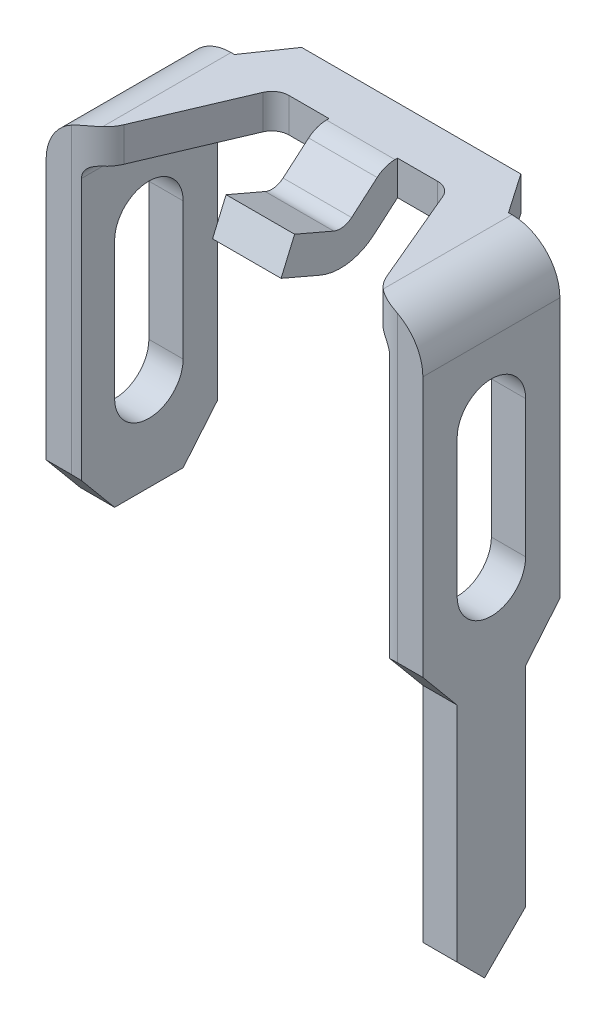
from build123d import *

# Parameters (mm, degrees)
BOSS_EXTRUDE1_DEPTH = 2.58
CUT_EXTRUDE1_DEPTH  = 10.5
CUT_EXTRUDE2_DEPTH  = 5.25
BOSS_EXTRUDE2_DEPTH = 0.5
SKETCH5_W           = 2.430822105
SKETCH5_H           = 5.029930807
CUT_EXTRUDE3_DEPTH  = 1
CHAMFER1_SIZE       = 0.6
CHAMFER2_SIZE       = 0.4


with BuildPart() as part:
    # Sketch1 → Boss-Extrude1 (new body)
    with BuildSketch(Plane.XY):
        with BuildLine():
            Line((-2.75, -4), (-2.75, 4.05))
            ThreePointArc((-2.75, 4.05), (-2.544974747, 4.544974747), (-2.05, 4.75))
            Line((-2.05, 4.75), (2.05, 4.75))
            ThreePointArc((2.05, 4.75), (2.544974747, 4.544974747), (2.75, 4.05))
            Line((2.75, 4.05), (2.75, -4))
            Line((2.75, -4), (2.25, -4))
            Line((2.25, -4), (2.25, 4.05))
            ThreePointArc((2.25, 4.05), (2.191421356, 4.191421356), (2.05, 4.25))
            Line((2.05, 4.25), (-2.05, 4.25))
            ThreePointArc((-2.05, 4.25), (-2.191421356, 4.191421356), (-2.25, 4.05))
            Line((-2.25, 4.05), (-2.25, -4))
            Line((-2.25, -4), (-2.75, -4))
        make_face()
    extrude(amount=BOSS_EXTRUDE1_DEPTH)

    # Sketch2 → Cut-Extrude1 (cut)
    with BuildSketch(Plane(origin=(0, 4.75, 0), x_dir=(1, 0, 0), z_dir=(0, 1, 0))):
        Polygon((-2, -0.58), (-4.099439411, -0.58), (-4.099439411, 0.833357165), (-2, 0.833357165), (-1.6, 0), align=None)
        Polygon((2, -0.58), (3.357409655, -0.58), (3.357409655, 0.833357165), (2, 0.833357165), (1.6, 0), align=None)
        with BuildLine():
            Line((-2.75, -2.58), (-2.38062097, -2.58))
            ThreePointArc((-2.38062097, -2.58), (-2.104839164, -2.497066416), (-1.920543652, -2.275777582))
            Line((-1.920543652, -2.275777582), (-1.314728174, -0.852111209))
            ThreePointArc((-1.314728174, -0.852111209), (-1.222580418, -0.741466792), (-1.084689515, -0.7))
            Line((-1.084689515, -0.7), (1.084290526, -0.7))
            ThreePointArc((1.084290526, -0.7), (1.222412736, -0.741619926), (1.314545856, -0.852621958))
            Line((1.314545856, -0.852621958), (1.915985292, -2.274756083))
            ThreePointArc((1.915985292, -2.274756083), (2.100251533, -2.496760148), (2.376495952, -2.58))
            Line((2.376495952, -2.58), (2.75, -2.58))
            Line((2.75, -2.58), (2.75, -3.056093585))
            Line((2.75, -3.056093585), (-2.75, -3.056093585))
            Line((-2.75, -3.056093585), (-2.75, -2.58))
        make_face()
    extrude(amount=-CUT_EXTRUDE1_DEPTH, mode=Mode.SUBTRACT)

    # Sketch3 → Cut-Extrude2 (cut, symmetric)
    with BuildSketch(Plane(origin=(0, 0, 0), x_dir=(0, 0, -1), z_dir=(1, 0, 0))):
        Polygon((-0.58, 0.25), (-1.08, -0.35), (-1.08, -4.396314828), (-0.130305992, -4.396314828), (-0.130305992, 0.25), align=None)
        Polygon((-2.58, 0.25), (-2.08, -0.35), (-2.08, -4.896314828), (-3.070294312, -4.896314828), (-3.070294312, 0.25), align=None)
        with BuildLine():
            Line((-1.08, 3.024565065), (-1.08, 1.024565065))
            ThreePointArc((-1.08, 1.024565065), (-1.58, 0.524565065), (-2.08, 1.024565065))
            Line((-2.08, 1.024565065), (-2.08, 3.024565065))
            ThreePointArc((-2.08, 3.024565065), (-1.58, 3.524565065), (-1.08, 3.024565065))
        make_face()
    extrude(amount=CUT_EXTRUDE2_DEPTH, both=True, mode=Mode.SUBTRACT)

    # Sketch4 → Boss-Extrude2 (add, symmetric)
    with BuildSketch(Plane(origin=(0, 0, 0), x_dir=(0, 0, -1), z_dir=(1, 0, 0))):
        with BuildLine():
            Line((-0.7, 4.25), (-1.045169213, 3.954140675))
            ThreePointArc((-1.045169213, 3.954140675), (-1.420160684, 3.782160221), (-1.829373497, 3.834512432))
            Line((-1.829373497, 3.834512432), (-2.4, 4.079724782))
            Line((-2.4, 4.079724782), (-2.202592831, 4.539105245))
            Line((-2.202592831, 4.539105245), (-1.631966328, 4.293892895))
            ThreePointArc((-1.631966328, 4.293892895), (-1.495562057, 4.276442158), (-1.3705649, 4.333768976))
            Line((-1.3705649, 4.333768976), (-0.997308957, 4.653702641))
            ThreePointArc((-0.997308957, 4.653702641), (-0.875770907, 4.725154006), (-0.736992408, 4.75))
            Line((-0.736992408, 4.75), (-0.7, 4.75))
            Line((-0.7, 4.75), (-0.7, 4.25))
        make_face()
    extrude(amount=BOSS_EXTRUDE2_DEPTH, both=True)

    # Sketch5 → Cut-Extrude3 (cut)
    with BuildSketch(Plane.ZY.offset(2.75)):
        with Locations((1.671482724, -2.864965403)):
            Rectangle(SKETCH5_W, SKETCH5_H)
    extrude(amount=-CUT_EXTRUDE3_DEPTH, mode=Mode.SUBTRACT)

    # Chamfer1
    chamfer1_edges = [part.edges().sort_by_distance(p)[0] for p in [
        (2.5, -4, 1.08),
    ]]
    chamfer(chamfer1_edges, length=CHAMFER1_SIZE)

    # Chamfer2
    chamfer2_edges = [part.edges().sort_by_distance(p)[0] for p in [
        (2.5, -4, 2.08),
    ]]
    chamfer(chamfer2_edges, length=CHAMFER2_SIZE - 0.0001)  # a hair under: the kernel refuses the full size


solid = part.part
